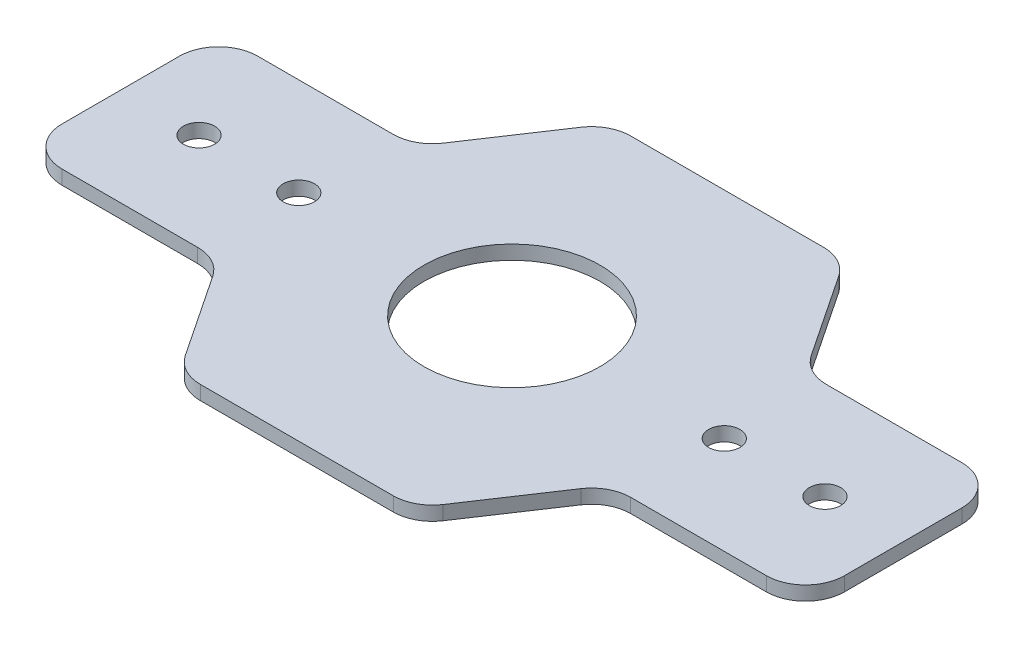
from build123d import *

# Parameters (mm, degrees)
SKETCH1_R           = 2.54
BOSS_EXTRUDE1_DEPTH = 2.286
FILLET1_R           = 6.35
SKETCH2_R           = 14.2875
CUT_EXTRUDE1_DEPTH  = 3.175
SKETCH3_R           = 2.54
CUT_EXTRUDE2_DEPTH  = 120.538577125


with BuildPart() as part:
    # Sketch1 → Boss-Extrude1 (new body)
    with BuildSketch(Plane(origin=(0, 0, 0), x_dir=(1, 0, 0), z_dir=(0, 1, 0))):
        Polygon((19.05, 15.875), (31.75, 34.925), (69.85, 34.925), (82.55, 15.875), (114.3, 15.875), (114.3, -15.875), (82.55, -15.875), (69.85, -34.925), (31.75, -34.925), (19.05, -15.875), (-12.7, -15.875), (-12.7, 15.875), align=None)
        Circle(SKETCH1_R, mode=Mode.SUBTRACT)
        with Locations((101.6, 0)):
            Circle(SKETCH1_R, mode=Mode.SUBTRACT)
    extrude(amount=BOSS_EXTRUDE1_DEPTH)

    # Fillet1
    fillet1_edges = [part.edges().sort_by_distance(p)[0] for p in [
        (19.05, 1.143, -15.875),
        (31.75, 1.143, -34.925),
        (69.85, 1.143, -34.925),
        (82.55, 1.143, -15.875),
        (114.3, 1.143, -15.875),
        (114.3, 1.143, 15.875),
        (82.55, 1.143, 15.875),
        (69.85, 1.143, 34.925),
        (31.75, 1.143, 34.925),
        (19.05, 1.143, 15.875),
        (-12.7, 1.143, -15.875),
        (-12.7, 1.143, 15.875),
    ]]
    fillet(fillet1_edges, radius=FILLET1_R)

    # Sketch2 → Cut-Extrude1 (cut)
    with BuildSketch(Plane(origin=(0, 2.286, 0), x_dir=(1, 0, 0), z_dir=(0, 1, 0))):
        with Locations((50.8, 0)):
            Circle(SKETCH2_R)
    extrude(amount=-CUT_EXTRUDE1_DEPTH, mode=Mode.SUBTRACT)

    # Sketch3 → Cut-Extrude2 (cut, through all)
    with BuildSketch(Plane(origin=(0, 2.286, 0), x_dir=(1, 0, 0), z_dir=(0, 1, 0))):
        with Locations((85.255689026, 0)):
            Circle(SKETCH3_R)
        with Locations((16.192906864, 0)):
            Circle(SKETCH3_R)
    extrude(amount=-CUT_EXTRUDE2_DEPTH, mode=Mode.SUBTRACT)


solid = part.part
